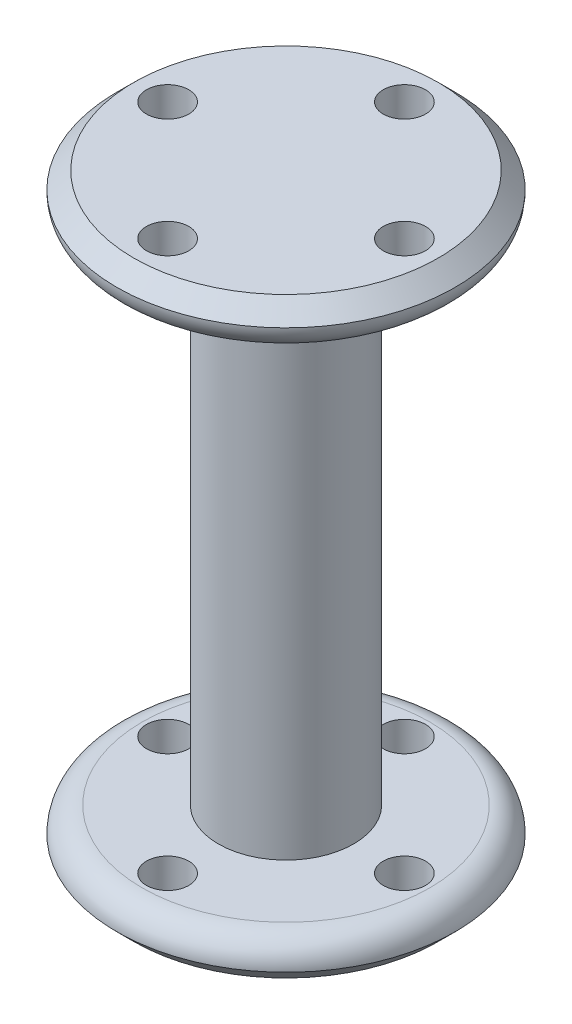
from build123d import *

# Parameters (mm, degrees)
SKETCH1_R                = 8
BOSS_EXTRUDE1_DEPTH      = 30
SKETCH3_R                = 20
BOSS_EXTRUDE2_DEPTH      = 5
CHAMFER1_SIZE            = 2
SKETCH4_R                = 2.5
CUT_EXTRUDE1_DEPTH       = 71.887234394
CIRPATTERN1_COUNT        = 4
FILLET1_R                = 3
MIRROR1_COPY_1_SKETCH_R  = 2.5
MIRROR1_COPY_1_DEPTH     = 71.887234394
MIRROR1_COPY_2_SKETCH_R  = 2.5
MIRROR1_COPY_2_DEPTH     = 71.887234394
MIRROR1_COPY_3_SKETCH_R  = 2.5
MIRROR1_COPY_3_DEPTH     = 71.887234394
CHAMFER1_OF_MIRROR1_SIZE = 2
FILLET1_OF_MIRROR1_R     = 3


with BuildPart() as part:
    # Sketch1 → Boss-Extrude1 (new, symmetric)
    with BuildSketch(Plane(origin=(0, 0, 0), x_dir=(1, 0, 0), z_dir=(0, 1, 0))):
        with Locations(Location((0, 0, 0), (0, 0, 270))):
            Circle(SKETCH1_R)
    extrude(amount=BOSS_EXTRUDE1_DEPTH, both=True)

    # Sketch3 → Boss-Extrude2 (add)
    with BuildSketch(Plane(origin=(0, 30, 0), x_dir=(1, 0, 0), z_dir=(0, 1, 0))):
        with Locations(Location((0, 0, 0), (0, 0, 270))):
            Circle(SKETCH3_R)
    boss_extrude2 = extrude(amount=BOSS_EXTRUDE2_DEPTH)

    # Chamfer1
    chamfer1_edges = [part.edges().sort_by_distance(p)[0] for p in [
        (0, 35, -20),
    ]]
    chamfer(chamfer1_edges, length=CHAMFER1_SIZE)

    # Sketch4 → Cut-Extrude1 (cut, through all)
    with BuildSketch(Plane(origin=(0, 35, 0), x_dir=(1, 0, 0), z_dir=(0, 1, 0))):
        with Locations(Location((0, 14, 0), (0, 0, 270))):
            Circle(SKETCH4_R)
    cut_extrude1 = extrude(amount=-CUT_EXTRUDE1_DEPTH, mode=Mode.SUBTRACT)

    # CirPattern1: Cut-Extrude1 ×4 about axis
    cirpattern1_axis = Axis((0, 0, 0), (0, 1, 0))
    for i in range(1, CIRPATTERN1_COUNT):
        add(cut_extrude1.rotate(cirpattern1_axis, i * 360 / CIRPATTERN1_COUNT), mode=Mode.SUBTRACT)

    # Fillet1
    fillet1_edges = [part.edges().sort_by_distance(p)[0] for p in [
        (0, 30, -20),
    ]]
    fillet(fillet1_edges, radius=FILLET1_R - 0.0001)  # a hair under: the kernel refuses the full size

    # Mirror1: Boss-Extrude2, Cut-Extrude1 across plane
    add(boss_extrude2.mirror(Plane.ZX))
    add(cut_extrude1.mirror(Plane.ZX), mode=Mode.SUBTRACT)

    # Mirror1 copy 1 sketch → Mirror1 copy 1 (cut, through all)
    with BuildSketch(Plane(origin=(0, -35, 0), x_dir=(0, 0, -1), z_dir=(0, -1, 0))):
        with Locations((0, -14)):
            Circle(MIRROR1_COPY_1_SKETCH_R)
    extrude(amount=-MIRROR1_COPY_1_DEPTH, mode=Mode.SUBTRACT)

    # Mirror1 copy 2 sketch → Mirror1 copy 2 (cut, through all)
    with BuildSketch(Plane(origin=(0, -35, 0), x_dir=(-1, 0, 0), z_dir=(0, -1, 0))):
        with Locations((0, -14)):
            Circle(MIRROR1_COPY_2_SKETCH_R)
    extrude(amount=-MIRROR1_COPY_2_DEPTH, mode=Mode.SUBTRACT)

    # Mirror1 copy 3 sketch → Mirror1 copy 3 (cut, through all)
    with BuildSketch(Plane(origin=(0, -35, 0), x_dir=(0, 0, 1), z_dir=(0, -1, 0))):
        with Locations((0, -14)):
            Circle(MIRROR1_COPY_3_SKETCH_R)
    extrude(amount=-MIRROR1_COPY_3_DEPTH, mode=Mode.SUBTRACT)

    # Chamfer1 of Mirror1
    chamfer1_of_mirror1_edges = [part.edges().sort_by_distance(p)[0] for p in [
        (0, -35, -20),
    ]]
    chamfer(chamfer1_of_mirror1_edges, length=CHAMFER1_OF_MIRROR1_SIZE)

    # Fillet1 of Mirror1
    fillet1_of_mirror1_edges = [part.edges().sort_by_distance(p)[0] for p in [
        (0, -30, -20),
    ]]
    fillet(fillet1_of_mirror1_edges, radius=FILLET1_OF_MIRROR1_R - 0.0001)  # a hair under: the kernel refuses the full size


solid = part.part
